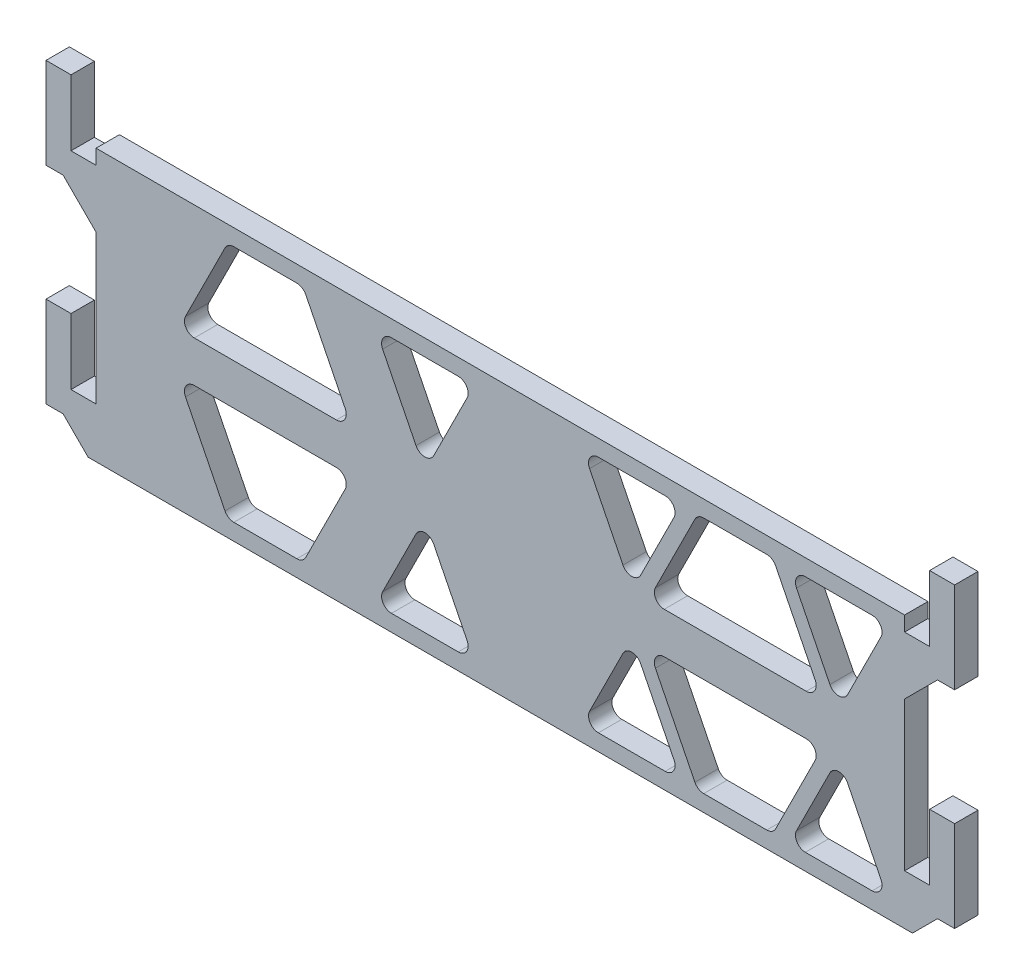
from build123d import *

# Parameters (mm, degrees)
SKETCH1_W            = 155.956
SKETCH1_H            = 68.320954018
BOSS_EXTRUDE1_DEPTH  = 4.5085
SKETCH2_W            = 155.956
SKETCH2_H            = 15.933454036
CUT_EXTRUDE1_DEPTH   = 10.795
BOSS_EXTRUDE2_DEPTH  = 4.5085
CUT_EXTRUDE2_DEPTH   = 4.7625
LPATTERN1_COUNT      = 3
LPATTERN1_PITCH      = 39.916133528
CUT_EXTRUDE3_DEPTH   = 4.7625
FILLET2_R            = 1.905
MIRROR3_COPY_1_DEPTH = 4.7625
MIRROR3_COPY_2_DEPTH = 4.7625
MIRROR3_COPY_3_DEPTH = 4.7625
FILLET3_R            = 1.905
CHAMFER1_SIZE        = 6.35


with BuildPart() as part:
    # Sketch1 → Boss-Extrude1 (new body)
    with BuildSketch(Plane.XY):
        Rectangle(SKETCH1_W, SKETCH1_H)
    extrude(amount=BOSS_EXTRUDE1_DEPTH)

    # Sketch2 → Cut-Extrude1 (cut)
    with BuildSketch(Plane.XY.offset(4.5085)):
        with Locations((0, 26.193749991)):
            Rectangle(SKETCH2_W, SKETCH2_H)
    extrude(amount=-CUT_EXTRUDE1_DEPTH, mode=Mode.SUBTRACT)

    # Sketch3 → Boss-Extrude2 (add)
    with BuildSketch(Plane.XY.offset(4.5085)):
        Polygon((-77.978, -29.334477009), (-87.63, -29.334477009), (-87.63, -25.589053013), (-87.63, -11.808477009), (-82.804, -11.808477009), (-82.804, -24.508477009), (-77.978, -24.508477009), align=None)
        Polygon((-77.978, 10.543522991), (-87.63, 10.543522991), (-87.63, 28.069522991), (-82.804, 28.069522991), (-82.804, 15.369522991), (-77.978, 15.369522991), align=None)
    boss_extrude2 = extrude(amount=-BOSS_EXTRUDE2_DEPTH)

    # Mirror1: Boss-Extrude2 across plane
    add(boss_extrude2.mirror(Plane(origin=(0, 0, 0), x_dir=(0, 0, 1), z_dir=(1, 0, 0))))

    # Sketch4 → Cut-Extrude2 (cut)
    with BuildSketch(Plane(origin=(0, 0, 0), x_dir=(-1, 0, 0), z_dir=(0, 0, -1))):
        Polygon((-74.803, 15.052022991), (-55.753, 15.052022991), (-65.278, -3.997977009), align=None)
    cut_extrude2 = extrude(amount=-CUT_EXTRUDE2_DEPTH, mode=Mode.SUBTRACT)

    # LPattern1: Cut-Extrude2 ×3
    with Locations(*[(-i * LPATTERN1_PITCH, 0, 0) for i in range(1, LPATTERN1_COUNT)]):
        add(cut_extrude2, mode=Mode.SUBTRACT)

    # Sketch5 → Cut-Extrude3 (cut)
    with BuildSketch(Plane(origin=(0, 0, 0), x_dir=(-1, 0, 0), z_dir=(0, 0, -1))):
        Polygon((-52.578, 15.052022991), (-38.061866472, 15.052022991), (-28.536866472, -3.997977009), (-62.103, -3.997977009), align=None)
    cut_extrude3 = extrude(amount=-CUT_EXTRUDE3_DEPTH, mode=Mode.SUBTRACT)

    # Mirror2: Cut-Extrude3 across plane
    add(cut_extrude3.mirror(Plane(origin=(0, 0, 0), x_dir=(0, 0, 1), z_dir=(1, 0, 0))), mode=Mode.SUBTRACT)

    # Fillet2
    fillet2_edges = [part.edges().sort_by_distance(p)[0] for p in [
        (65.278, -3.997977009, 2.25425),
        (74.803, 15.052022991, 2.25425),
        (55.753, 15.052022991, 2.25425),
        (25.361866472, -3.997977009, 2.25425),
        (34.886866472, 15.052022991, 2.25425),
        (15.836866472, 15.052022991, 2.25425),
        (-5.029267056, 15.052022991, 2.25425),
        (-14.554267056, -3.997977009, 2.25425),
        (-24.079267056, 15.052022991, 2.25425),
    ]]
    fillet(fillet2_edges, radius=FILLET2_R)

    # Mirror3: Cut-Extrude2, Cut-Extrude3 across plane
    add(cut_extrude2.mirror(Plane.ZX.offset(-7.966727018)), mode=Mode.SUBTRACT)
    add(cut_extrude3.mirror(Plane.ZX.offset(-7.966727018)), mode=Mode.SUBTRACT)

    # Mirror3 copy 1 sketch → Mirror3 copy 1 (cut)
    with BuildSketch(Plane(origin=(-39.916133528, -15.933454036, 0), x_dir=(-1, 0, 0), z_dir=(0, 0, -1))):
        Polygon((-74.803, -15.052022991), (-55.753, -15.052022991), (-65.278, 3.997977009), align=None)
    extrude(amount=-MIRROR3_COPY_1_DEPTH, mode=Mode.SUBTRACT)

    # Mirror3 copy 2 sketch → Mirror3 copy 2 (cut)
    with BuildSketch(Plane(origin=(-79.832267056, -15.933454036, 0), x_dir=(-1, 0, 0), z_dir=(0, 0, -1))):
        Polygon((-74.803, -15.052022991), (-55.753, -15.052022991), (-65.278, 3.997977009), align=None)
    extrude(amount=-MIRROR3_COPY_2_DEPTH, mode=Mode.SUBTRACT)

    # Mirror3 copy 3 sketch → Mirror3 copy 3 (cut)
    with BuildSketch(Plane(origin=(0, -15.933454036, 0), x_dir=(1, 0, 0), z_dir=(0, 0, -1))):
        Polygon((-52.578, 15.052022991), (-38.061866472, 15.052022991), (-28.536866472, -3.997977009), (-62.103, -3.997977009), align=None)
    extrude(amount=-MIRROR3_COPY_3_DEPTH, mode=Mode.SUBTRACT)

    # Fillet3
    fillet3_edges = [part.edges().sort_by_distance(p)[0] for p in [
        (62.103, -3.997977009, 2.25425),
        (52.578, 15.052022991, 2.25425),
        (38.061866472, 15.052022991, 2.25425),
        (28.536866472, -3.997977009, 2.25425),
        (-52.578, 15.052022991, 2.25425),
        (-62.103, -3.997977009, 2.25425),
        (-28.536866472, -3.997977009, 2.25425),
        (-38.061866472, 15.052022991, 2.25425),
        (74.803, -30.985477027, 2.25425),
        (65.278, -11.935477027, 2.25425),
        (55.753, -30.985477027, 2.25425),
        (34.886866472, -30.985477027, 2.25425),
        (25.361866472, -11.935477027, 2.25425),
        (15.836866472, -30.985477027, 2.25425),
        (-5.029267056, -30.985477027, 2.25425),
        (-14.554267056, -11.935477027, 2.25425),
        (-24.079267056, -30.985477027, 2.25425),
        (-62.103, -11.935477027, 2.25425),
        (-52.578, -30.985477027, 2.25425),
        (-38.061866472, -30.985477027, 2.25425),
        (-28.536866472, -11.935477027, 2.25425),
        (52.578, -30.985477027, 2.25425),
        (62.103, -11.935477027, 2.25425),
        (28.536866472, -11.935477027, 2.25425),
        (38.061866472, -30.985477027, 2.25425),
    ]]
    fillet(fillet3_edges, radius=FILLET3_R)

    # Chamfer1
    # the kernel refuses this chamfer: 6.35 mm, written as the material it adds along each edge
    with BuildSketch(Plane(origin=(-77.978, -29.334477009, 4.5085), x_dir=(-0.9996219169112966, 0.027495876610585696, 0), z_dir=(0, 0, -1))) as chamfer1_piece_1_section:
        Polygon((CHAMFER1_SIZE * 0.999621916911, -CHAMFER1_SIZE * 0.0274958766106), (-CHAMFER1_SIZE * 0.0274958766106, -CHAMFER1_SIZE * 0.999621916911), (0, 0), align=None)
    chamfer1_piece_1 = extrude(amount=4.5085, mode=Mode.PRIVATE)
    chamfer1_piece_1 = split(chamfer1_piece_1, bisect_by=Plane(origin=(-80.204608327, -34.160477009, 2.25425), z_dir=(0, 1, 0)), keep=Keep.TOP, mode=Mode.PRIVATE)
    add(chamfer1_piece_1)
    with BuildSketch(Plane(origin=(-77.978, 10.543522991, 4.5085), x_dir=(-0.9996219169112966, 0.02749587661058624, 0), z_dir=(0, 0, -1))) as chamfer1_piece_2:
        Polygon((CHAMFER1_SIZE * 0.999621916911, -CHAMFER1_SIZE * 0.0274958766106), (-CHAMFER1_SIZE * 0.0274958766106, -CHAMFER1_SIZE * 0.999621916911), (0, 0), align=None)
    extrude(amount=4.5085)
    with BuildSketch(Plane(origin=(77.978, -29.334477009, 4.5085), x_dir=(0.9996219169112966, 0.027495876610585696, 0), z_dir=(0, 0, -1))) as chamfer1_piece_3_section:
        Polygon((CHAMFER1_SIZE * 0.999621916911, CHAMFER1_SIZE * 0.0274958766106), (-CHAMFER1_SIZE * 0.0274958766106, CHAMFER1_SIZE * 0.999621916911), (0, 0), align=None)
    chamfer1_piece_3 = extrude(amount=4.5085, mode=Mode.PRIVATE)
    chamfer1_piece_3 = split(chamfer1_piece_3, bisect_by=Plane(origin=(80.204608327, -34.160477009, 2.25425), z_dir=(0, 1, 0)), keep=Keep.TOP, mode=Mode.PRIVATE)
    add(chamfer1_piece_3)
    with BuildSketch(Plane(origin=(77.978, 10.543522991, 4.5085), x_dir=(0.9996219169112966, 0.027495876610585966, 0), z_dir=(0, 0, -1))) as chamfer1_piece_4:
        Polygon((CHAMFER1_SIZE * 0.999621916911, CHAMFER1_SIZE * 0.0274958766106), (-CHAMFER1_SIZE * 0.0274958766106, CHAMFER1_SIZE * 0.999621916911), (0, 0), align=None)
    extrude(amount=4.5085)


solid = part.part
